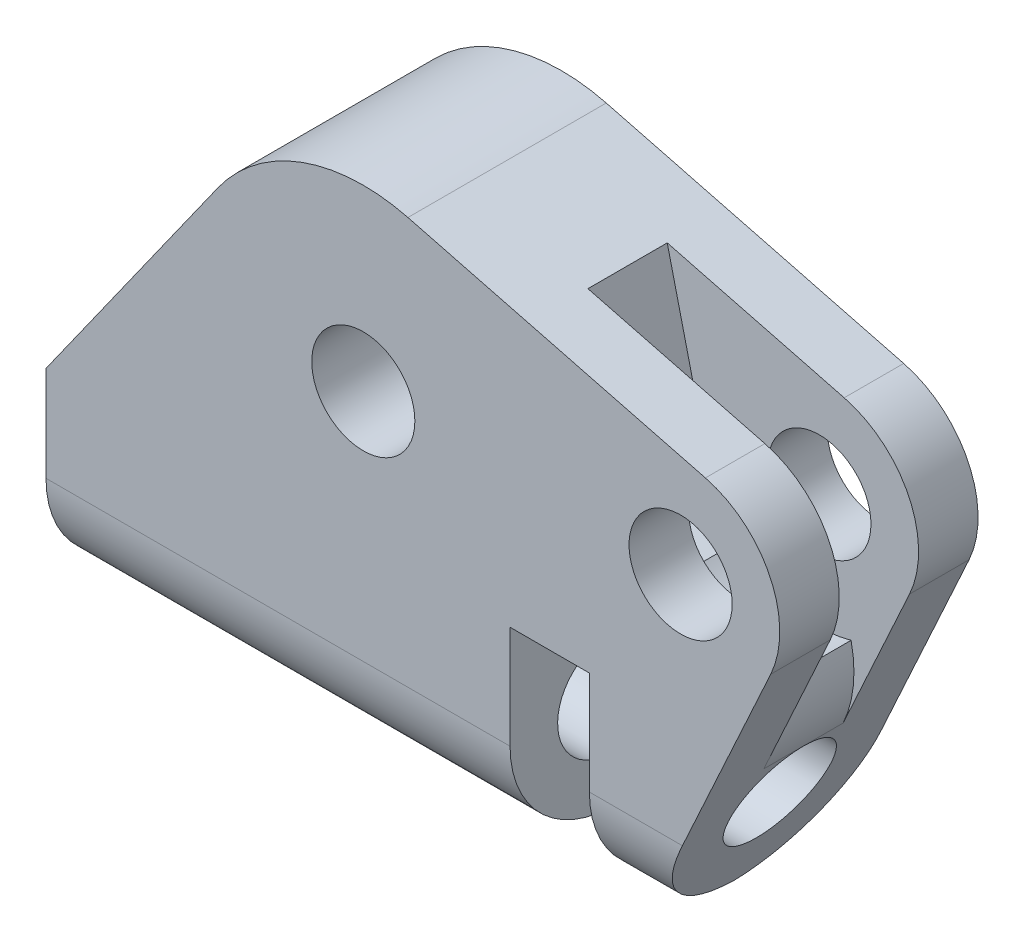
from build123d import *

# Parameters (mm, degrees)
SKETCH1_R           = 22.5
SKETCH1_R_2         = 6.5
BOSS_EXTRUDE1_DEPTH = 12.5
SKETCH2_R           = 6.5
BOSS_EXTRUDE2_DEPTH = 12.5
SKETCH3_R           = 6.5
CUT_EXTRUDE1_DEPTH  = 901.750681353
FILLET1_R           = 13
SKETCH4_W           = 10
SKETCH4_H           = 25.980762113
CUT_EXTRUDE2_DEPTH  = 1021.222656563
SKETCH5_R           = 6.5
CUT_EXTRUDE3_DEPTH  = 5
SKETCH6_W           = 23.820751316
SKETCH6_H           = 10
CUT_EXTRUDE4_DEPTH  = 25
FILLET2_R           = 15


with BuildPart() as part:
    # Sketch1 → Boss-Extrude1 (new, symmetric)
    with BuildSketch(Plane.XY):
        with Locations((434.94970424, -853.401384058)):
            Circle(SKETCH1_R)
        with Locations((434.94970424, -853.401384058)):
            Circle(SKETCH1_R_2, mode=Mode.SUBTRACT)
    extrude(amount=BOSS_EXTRUDE1_DEPTH, both=True)

    # Sketch2 → Boss-Extrude2 (add, symmetric)
    with BuildSketch(Plane.XY):
        with BuildLine():
            Line((440.57470424, -831.615852736), (478.07470424, -841.298311101))
            ThreePointArc((478.07470424, -841.298311101), (486.236797951, -848.030023379), (486.312946026, -858.609717392))
            Line((486.312946026, -858.609717392), (474.94970424, -883.401384058))
            Line((474.94970424, -883.401384058), (469.220338634, -895.901384058))
            Line((469.220338634, -895.901384058), (394.94970424, -895.901384058))
            Line((394.94970424, -895.901384058), (394.94970424, -870.901384058))
            Line((394.94970424, -870.901384058), (416.598084064, -840.383395085))
            ThreePointArc((416.598084064, -840.383395085), (427.222533672, -832.269871216), (440.57470424, -831.615852736))
        make_face()
        with Locations((474.94970424, -853.401384058)):
            Circle(SKETCH2_R, mode=Mode.SUBTRACT)
        with Locations((434.94970424, -853.401384058)):
            Circle(SKETCH2_R, mode=Mode.SUBTRACT)
    extrude(amount=BOSS_EXTRUDE2_DEPTH, both=True)

    # Sketch3 → Cut-Extrude1 (cut, through all)
    with BuildSketch(Plane.ZY.offset(-394.94970424)):
        with Locations(Location((0, -883.401384058, 0), (0, 0, 270))):
            Circle(SKETCH3_R)
    extrude(amount=-CUT_EXTRUDE1_DEPTH, mode=Mode.SUBTRACT)

    # Fillet1
    # the kernel refuses this fillet: 13 mm, written as the material it takes off along each edge
    with BuildSketch(Plane(origin=(501.720338634, -895.901384058, -12.5), x_dir=(0, 1, 0), z_dir=(-1, 0, 0))) as fillet1_piece_1:
        with BuildLine():
            CenterArc((FILLET1_R, -FILLET1_R), FILLET1_R, 90, 90)
            Line((0, -FILLET1_R), (0, 0))
            Line((0, 0), (FILLET1_R, 0))
        make_face()
    extrude(amount=139.270634394, mode=Mode.SUBTRACT)
    with BuildSketch(Plane(origin=(501.720338634, -895.901384058, 12.5), x_dir=(0, 1, 0), z_dir=(-1, 0, 0))) as fillet1_piece_2:
        with BuildLine():
            CenterArc((FILLET1_R, FILLET1_R), FILLET1_R, 180, 90)
            Line((0, FILLET1_R), (0, 0))
            Line((0, 0), (FILLET1_R, 0))
        make_face()
    extrude(amount=139.270634394, mode=Mode.SUBTRACT)

    # Sketch4 → Cut-Extrude2 (cut, through all)
    with BuildSketch(Plane.XY.offset(12.5)):
        with Locations((458.44970424, -882.901384059)):
            Rectangle(SKETCH4_W, SKETCH4_H)
    extrude(amount=-CUT_EXTRUDE2_DEPTH, mode=Mode.SUBTRACT)

    # Sketch5 → Cut-Extrude3 (cut, symmetric)
    with BuildSketch(Plane.XY):
        with BuildLine():
            Line((470.959579505, -839.461193794), (455.767141872, -835.538523265))
            Line((455.767141872, -835.538523265), (460.847639703, -856.775072808))
            ThreePointArc((460.847639703, -856.775072808), (487.47066386, -860.7140833), (470.959579505, -839.461193794))
        make_face()
        with Locations((474.94970424, -853.401384058)):
            Circle(SKETCH5_R, mode=Mode.SUBTRACT)
    extrude(amount=CUT_EXTRUDE3_DEPTH, both=True, mode=Mode.SUBTRACT)

    # Sketch6 → Cut-Extrude4 (cut)
    with BuildSketch(Plane(origin=(-173.766227741, -672.993706172, 0), x_dir=(0.9682458365518545, -0.24999999999999928, 0), z_dir=(0.24999999999999928, 0.9682458365518545, 0))):
        with Locations((672.317952287, 0)):
            Rectangle(SKETCH6_W, SKETCH6_H)
    extrude(amount=-CUT_EXTRUDE4_DEPTH, mode=Mode.SUBTRACT)

    # Fillet2
    # the kernel refuses this fillet: 15 mm, written as the material it takes off along each edge
    with BuildSketch(Plane(origin=(481.95399382, -868.119828339, 5), x_dir=(-0.9682458365518494, 0.2500000000000187, 0), z_dir=(0, 0, -1))) as fillet2_piece_1:
        with BuildLine():
            CenterArc((16.462547076, -6.840323223), FILLET2_R, 152.869318281, 37.277487885)
            Line((1.697153218, -9.482887166), (0, 0))
            Line((0, 0), (3.113016066, 0))
        make_face()
    extrude(amount=10, mode=Mode.SUBTRACT)


solid = part.part
